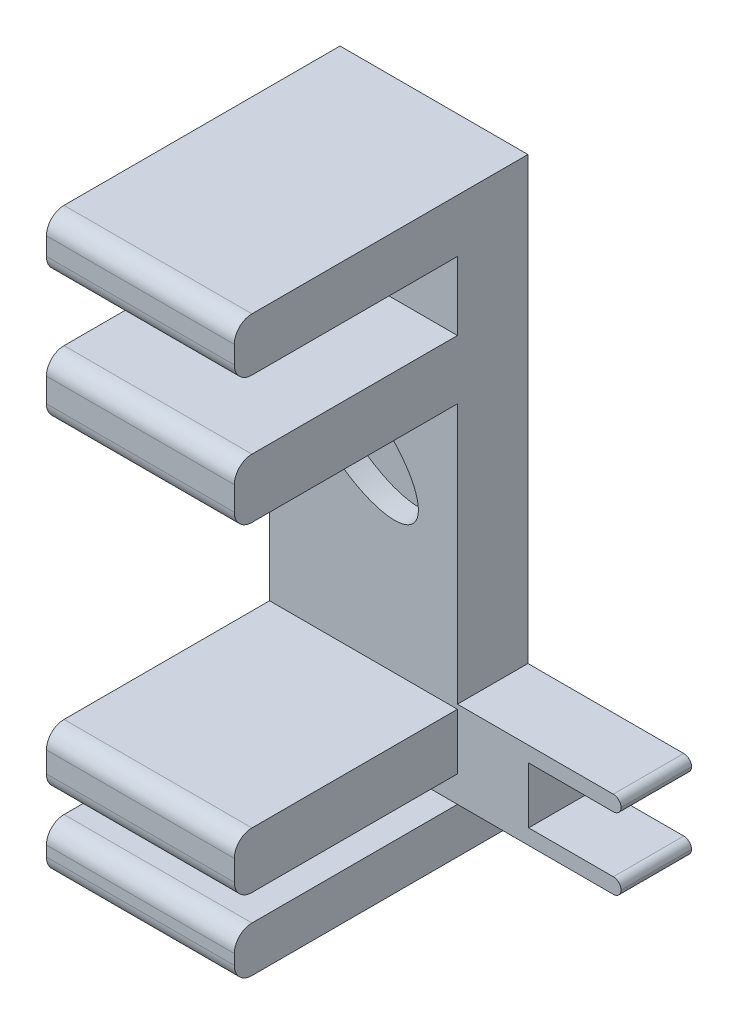
from build123d import *

# Parameters (mm, degrees)
BOSS_EXTRUDE2_DEPTH = 15
FILLET1_R           = 3.33
SKETCH3_W           = 80
SKETCH3_H           = 22.592249713
BOSS_EXTRUDE3_DEPTH = 110
SKETCH4_W           = 80
SKETCH4_H           = 25.180318724
SKETCH4_H_2         = 19.389592809
SKETCH4_H_3         = 23.819220414
BOSS_EXTRUDE4_DEPTH = 110
FILLET2_R           = 7.5
SKETCH5_RX          = 31.460220339
SKETCH5_RY          = 15.185408179
CUT_EXTRUDE1_DEPTH  = 10


with BuildPart() as part:
    # Sketch2 → Boss-Extrude2 (new, symmetric)
    with BuildSketch(Plane.XY):
        Polygon((80, 244), (80, 56.32), (80, 0), (0, 0), (0, 244), align=None)
        Polygon((149.68, 56.32), (80, 56.32), (80, 19.389592809), (149.68, 19.389592809), (149.68, 25.879592809), (110.31, 25.879592809), (110.31, 49.83), (149.68, 49.83), align=None)
    extrude(amount=BOSS_EXTRUDE2_DEPTH, both=True)

    # Fillet1
    # the kernel refuses this fillet: 3.33 mm, written as the material it takes off along each edge
    with BuildSketch(Plane(origin=(149.68, 19.389592809, -23.325), x_dir=(-1, 0, 0), z_dir=(0, 0, 1)), Plane(origin=(149.68, 25.879592809, -23.325), x_dir=(0, -1, 0), z_dir=(0, 0, 1)), Plane(origin=(149.68, 49.83, 23.325), x_dir=(0, 1, 0), z_dir=(0, 0, -1)), Plane(origin=(149.68, 56.32, 23.325), x_dir=(-1, 0, 0), z_dir=(0, 0, -1))) as fillet1_piece_1:
        with BuildLine():
            CenterArc((FILLET1_R, -FILLET1_R), FILLET1_R, 90, 90)
            Line((0, -FILLET1_R), (0, 0))
            Line((0, 0), (FILLET1_R, 0))
        make_face()
    extrude(amount=46.65, mode=Mode.SUBTRACT)

    # Sketch3 → Boss-Extrude3 (add)
    with BuildSketch(Plane.XY):
        with Locations((40, 232.703875144)):
            Rectangle(SKETCH3_W, SKETCH3_H)
    extrude(amount=BOSS_EXTRUDE3_DEPTH)

    # Sketch4 → Boss-Extrude4 (add)
    with BuildSketch(Plane.XY):
        with Locations((40, 179.676540861)):
            Rectangle(SKETCH4_W, SKETCH4_H)
        with Locations((40, 9.694796404)):
            Rectangle(SKETCH4_W, SKETCH4_H_2)
        with Locations((40, 42.545886188)):
            Rectangle(SKETCH4_W, SKETCH4_H_3)
    extrude(amount=BOSS_EXTRUDE4_DEPTH)

    # Fillet2
    fillet2_edges = [part.edges().sort_by_distance(p)[0] for p in [
        (40, 167.086381499, 110),
        (40, 192.266700223, 110),
        (40, 0, 110),
        (40, 19.389592809, 110),
        (40, 30.636275981, 110),
        (40, 54.455496395, 110),
        (40, 221.407750287, 110),
        (40, 244, 110),
    ]]
    fillet(fillet2_edges, radius=FILLET2_R)

    # Sketch5 → Cut-Extrude1 (cut)
    with BuildSketch(Plane.XY.offset(15)):
        with Locations(Location((37.068979408, 133.739472919), (0, 0, -38.85337434))):
            Ellipse(SKETCH5_RX, SKETCH5_RY)
    extrude(amount=-CUT_EXTRUDE1_DEPTH, mode=Mode.SUBTRACT)


solid = part.part
